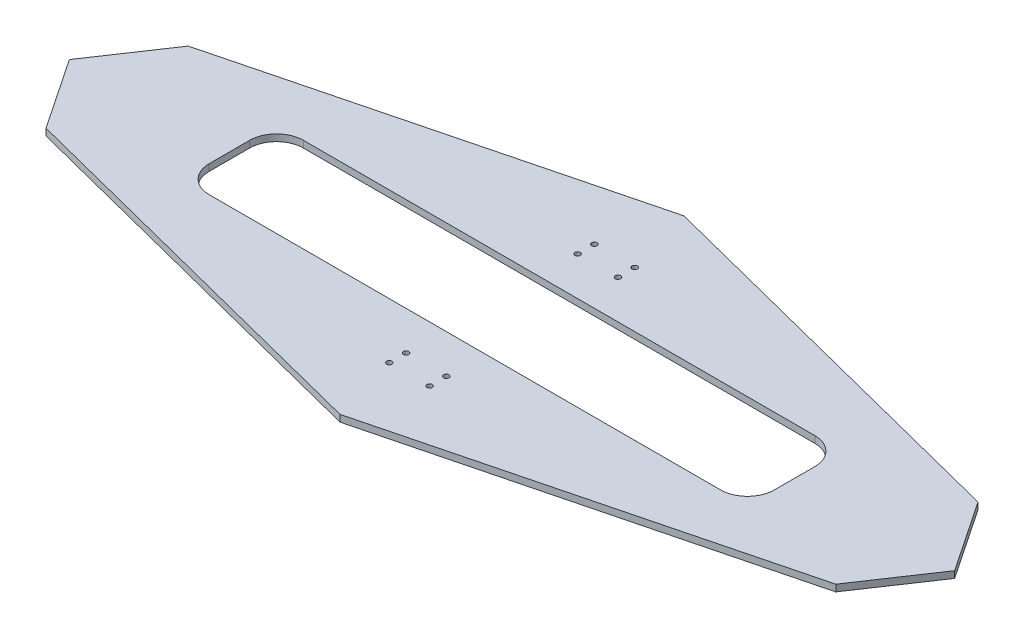
from build123d import *

# Parameters (mm, degrees)
BOSS_EXTRUDE1_DEPTH     = 3.175
CUT_EXTRUDE1_DEPTH      = 449.202604765
CUT_EXTRUDE1_DEPTH_BACK = 449.202604765
SKETCH2_R               = 2.54


with BuildPart() as part:
    # Sketch1 → Boss-Extrude1 (new, symmetric)
    with BuildSketch(Plane(origin=(0, 0, 0), x_dir=(1, 0, 0), z_dir=(0, 1, 0))):
        Polygon((-372.691935385, 67.129264749), (0, 162.283527596), (372.691935385, 67.129264749), (417.779308923, 0), (372.691935385, -67.129264749), (0, -162.283527596), (-372.691935385, -67.129264749), (-417.779308923, 0), align=None)
    extrude(amount=BOSS_EXTRUDE1_DEPTH, both=True)

    # Sketch2 → Cut-Extrude1 (cut, two sides: drawn at the far end of the back side and taken through both)
    with BuildSketch(Plane(origin=(0, 0, 0), x_dir=(1, 0, 0), z_dir=(0, 1, 0)).offset(-CUT_EXTRUDE1_DEPTH_BACK)):
        with Locations((19.05, 96.8375)):
            Circle(SKETCH2_R)
        with Locations((-19.05, 96.8375)):
            Circle(SKETCH2_R)
        with Locations((-19.05, 80.9625)):
            Circle(SKETCH2_R)
        with Locations((19.05, 80.9625)):
            Circle(SKETCH2_R)
        with Locations((19.05, -80.9625)):
            Circle(SKETCH2_R)
        with Locations((-19.05, -80.9625)):
            Circle(SKETCH2_R)
        with Locations((-19.05, -96.8375)):
            Circle(SKETCH2_R)
        with Locations((19.05, -96.8375)):
            Circle(SKETCH2_R)
        with BuildLine():
            Line((241.3, 44.45), (-241.3, 44.45))
            ThreePointArc((-241.3, 44.45), (-259.260512242, 37.010512242), (-266.7, 19.05))
            Line((-266.7, 19.05), (-266.7, -19.05))
            ThreePointArc((-266.7, -19.05), (-259.260512242, -37.010512242), (-241.3, -44.45))
            Line((-241.3, -44.45), (241.3, -44.45))
            ThreePointArc((241.3, -44.45), (259.260512242, -37.010512242), (266.7, -19.05))
            Line((266.7, -19.05), (266.7, 19.05))
            ThreePointArc((266.7, 19.05), (259.260512242, 37.010512242), (241.3, 44.45))
        make_face()
    extrude(amount=CUT_EXTRUDE1_DEPTH + CUT_EXTRUDE1_DEPTH_BACK, mode=Mode.SUBTRACT)


solid = part.part
